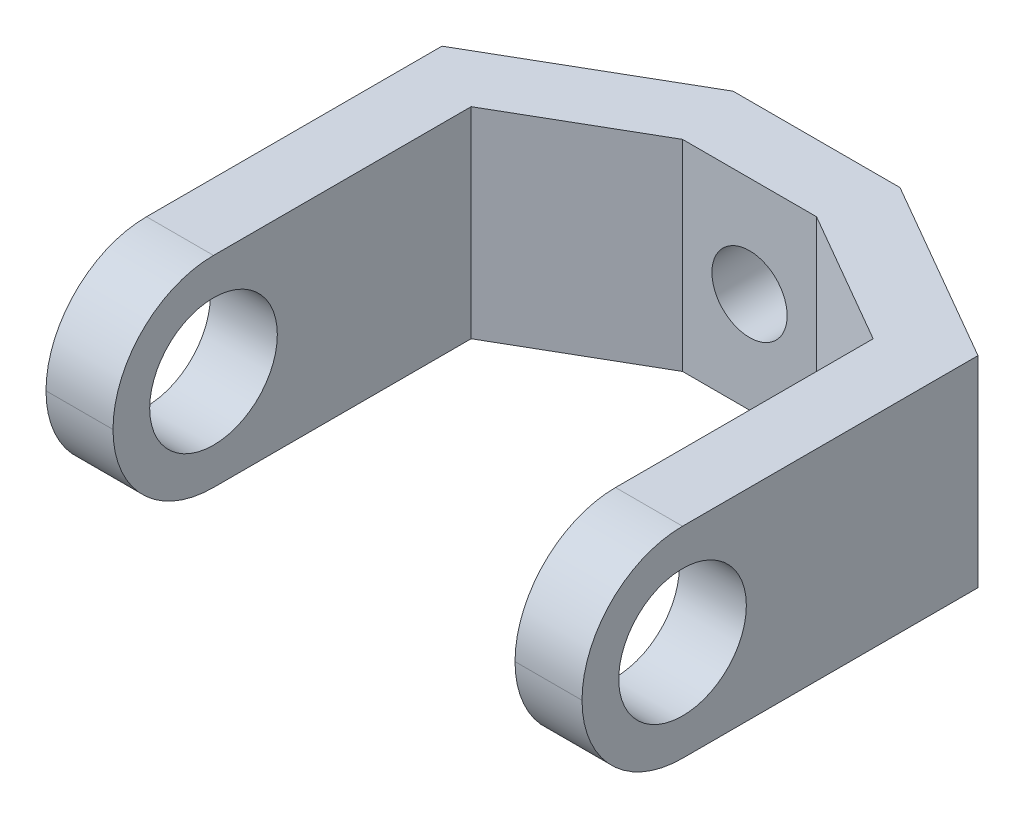
from build123d import *

# Parameters (mm, degrees)
BOSS_EXTRUDE1_DEPTH     = 7.5
CUT_EXTRUDE1_DEPTH      = 37.827299657
CUT_EXTRUDE1_DEPTH_BACK = 37.827299657
SKETCH3_R               = 4.7625
FILLET1_R               = 7.5
SKETCH4_R               = 2.8067
CUT_EXTRUDE2_DEPTH      = 37.827299657


with BuildPart() as part:
    # Sketch1 → Boss-Extrude1 (new, symmetric)
    with BuildSketch(Plane(origin=(0, 0, 0), x_dir=(1, 0, 0), z_dir=(0, 1, 0))):
        Polygon((-15, -7.5), (-20, -7.5), (-20, 22.049394585), (-6.22914747, 30), (6.22914747, 30), (20, 22.049394585), (20, -7.5), (15, -7.5), (15, 19.226497308), (5, 25), (-5, 25), (-15, 19.226497308), align=None)
    extrude(amount=BOSS_EXTRUDE1_DEPTH, both=True)

    # Sketch3 → Cut-Extrude1 (cut, two sides: drawn at the far end of the back side and taken through both)
    with BuildSketch(Plane(origin=(0, 0, 0), x_dir=(0, 0, -1), z_dir=(1, 0, 0)).offset(-CUT_EXTRUDE1_DEPTH_BACK)):
        Circle(SKETCH3_R)
    extrude(amount=CUT_EXTRUDE1_DEPTH + CUT_EXTRUDE1_DEPTH_BACK, mode=Mode.SUBTRACT)

    # Fillet1
    fillet1_edges = [part.edges().sort_by_distance(p)[0] for p in [
        (17.5, 7.5, 7.5),
        (17.5, -7.5, 7.5),
        (-17.5, -7.5, 7.5),
        (-17.5, 7.5, 7.5),
    ]]
    fillet(fillet1_edges, radius=FILLET1_R - 0.0001)  # a hair under: the kernel refuses the full size

    # Sketch4 → Cut-Extrude2 (cut, through all)
    with BuildSketch(Plane.XY):
        Circle(SKETCH4_R)
    extrude(amount=-CUT_EXTRUDE2_DEPTH, mode=Mode.SUBTRACT)


solid = part.part
